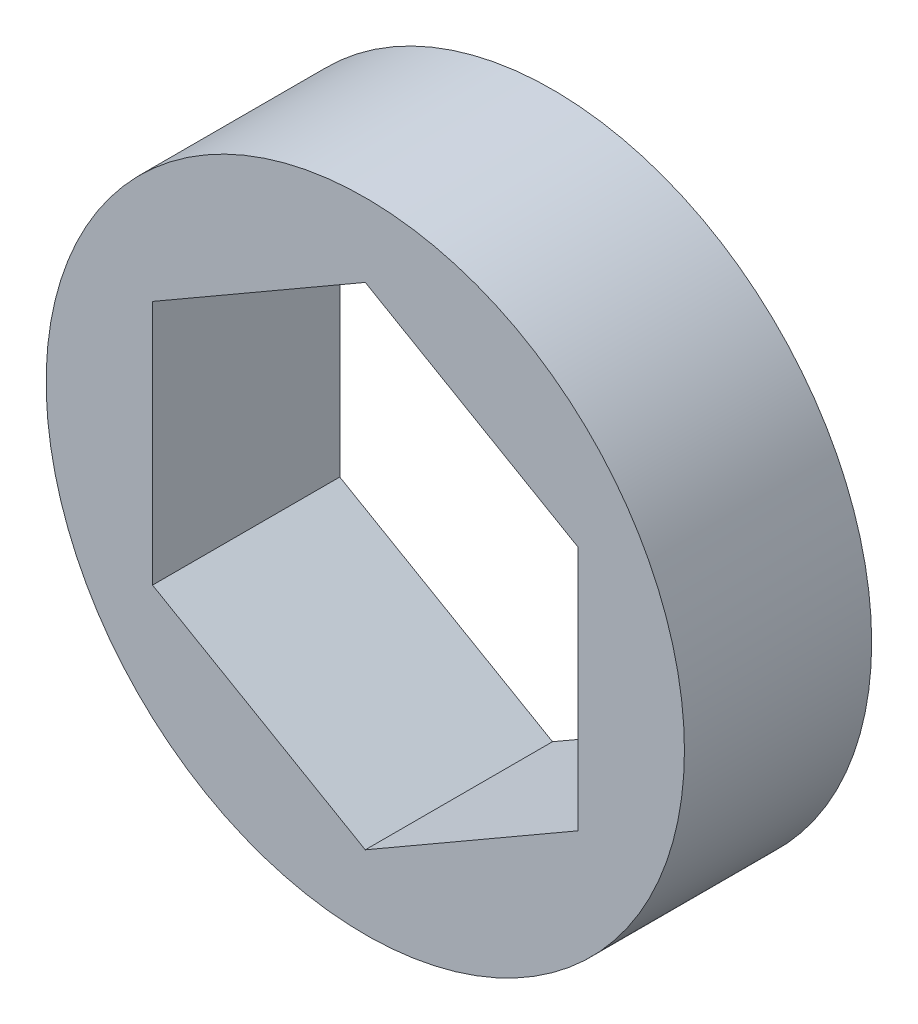
from build123d import *

# Parameters (mm, degrees)
SKETCH1_R           = 9.525
BOSS_EXTRUDE1_DEPTH = 5.588


with BuildPart() as part:
    # Sketch1 → Boss-Extrude1 (new body)
    with BuildSketch(Plane.XY):
        Circle(SKETCH1_R)
        Polygon((0, 7.332348419), (-6.35, 3.666174209), (-6.35, -3.666174209), (0, -7.332348419), (6.35, -3.666174209), (6.35, 3.666174209), align=None, mode=Mode.SUBTRACT)
    extrude(amount=BOSS_EXTRUDE1_DEPTH)


solid = part.part
